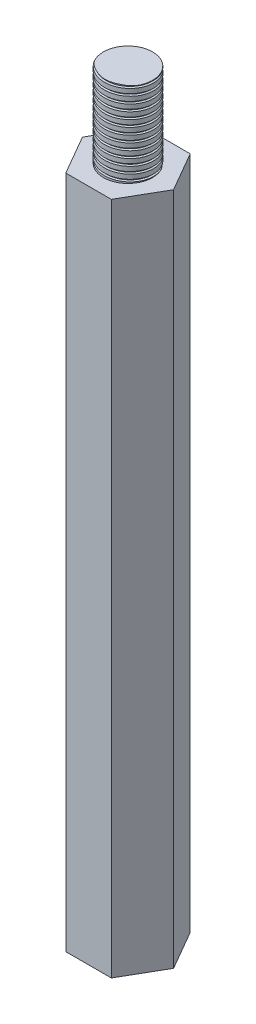
from build123d import *

# Parameters (mm, degrees)
SKETCH_1_R          = 1.46
EXTRUDE_1_DEPTH     = 40
SKETCH_1_3_R        = 1.46
CUT_EXTRUDE_1_DEPTH = 5
SKETCH_2_R          = 1.46
EXTRUDE_2_DEPTH     = 5
SWEEP_1_PITCH       = 0.4
SWEEP_1_FROM        = -0.1
SWEEP_2_PITCH       = 0.4


with BuildPart() as part:
    # 草图1 → 凸台-拉伸1 (new body)
    # profile 1 of 2: a face of its own
    with BuildSketch(Plane(origin=(0, 0, 0), x_dir=(1, 0, 0), z_dir=(0, 1, 0))):
        Polygon((-2.70199926, 0), (-1.35099963, -2.34), (1.35099963, -2.34), (2.70199926, 0), (1.35099963, 2.34), (-1.35099963, 2.34), align=None)
        Circle(SKETCH_1_R, mode=Mode.SUBTRACT)
    # profile 2 of 2: a face of its own
    with BuildSketch(Plane(origin=(0, 0, 0), x_dir=(1, 0, 0), z_dir=(0, 1, 0))):
        Circle(SKETCH_1_R)
    extrude(amount=EXTRUDE_1_DEPTH)

    # 草图1<3> → 切除-拉伸1 (cut)
    with BuildSketch(Plane(origin=(0, 0, 0), x_dir=(1, 0, 0), z_dir=(0, 1, 0))):
        with Locations(Location((0, 0, 0), (0, 0, 270))):
            Circle(SKETCH_1_3_R)
    extrude(amount=CUT_EXTRUDE_1_DEPTH, mode=Mode.SUBTRACT)

    # 切除-扫描2: arcs per turn and ends read off the stored shape
    # 切除-扫描2: the profile of 草图7 profile screwed along a right-hand helix through 23.75 turns, 6 arcs to a turn; built about Z, then put on its axis
    sweep_2_z = Axis((0, 0, 0), (0, 0, 1))
    sweep_2_corners = [(1.4597, 0, 0.1001), (1.66, 0, 0.033333333), (1.66, 0, -0.033333333), (1.4597, 0, -0.1001)]
    with BuildLine(mode=Mode.PRIVATE) as sweep_2_profile:
        Line(sweep_2_corners[0], sweep_2_corners[1])
        Line(sweep_2_corners[1], sweep_2_corners[2])
        Line(sweep_2_corners[2], sweep_2_corners[3])
        Line(sweep_2_corners[3], sweep_2_corners[0])
    sweep_2_cap = Face(sweep_2_profile.wire())
    sweep_2_turn_angles = [0, 30, 60, 90, 120, 150, 180, 210, 240, 270, 300, 330, 360]
    sweep_2_turn_weights = [1, 0.8660254037844387, 1, 0.8660254037844387, 1, 0.8660254037844387, 1, 0.8660254037844387, 1, 0.8660254037844387, 1, 0.8660254037844387, 1]
    sweep_2_turn_rails = [Edge.make_bspline([Vector(p[0], p[1], 0).rotate(sweep_2_z, sweep_2_turn_angles[k]) / sweep_2_turn_weights[k] + Vector(0, 0, p[2] + SWEEP_2_PITCH * sweep_2_turn_angles[k] / 360) for k in range(13)], [0, 0, 0, 1, 1, 2, 2, 3, 3, 4, 4, 5, 5, 6, 6, 6], 2, sweep_2_turn_weights) for p in sweep_2_corners]
    sweep_2_turn_sides = [Face.make_surface_from_curves(sweep_2_turn_rails[p[0]], sweep_2_turn_rails[p[1]]) for p in [(0, 1), (1, 2), (2, 3), (3, 0)]]
    sweep_2_last_angles = [8280, 8310, 8340, 8370, 8400, 8430, 8460, 8490, 8520, 8535, 8550]
    sweep_2_last_weights = [1, 0.8660254037844387, 1, 0.8660254037844387, 1, 0.8660254037844387, 1, 0.8660254037844387, 1, 0.965925826289056, 1]
    sweep_2_last_rails = [Edge.make_bspline([Vector(p[0], p[1], 0).rotate(sweep_2_z, sweep_2_last_angles[k]) / sweep_2_last_weights[k] + Vector(0, 0, p[2] + SWEEP_2_PITCH * sweep_2_last_angles[k] / 360) for k in range(11)], [0, 0, 0, 1, 1, 2, 2, 3, 3, 4, 4, 5, 5, 5], 2, sweep_2_last_weights) for p in sweep_2_corners]
    sweep_2_last_sides = [Face.make_surface_from_curves(sweep_2_last_rails[p[0]], sweep_2_last_rails[p[1]]) for p in [(0, 1), (1, 2), (2, 3), (3, 0)]]
    sweep_2 = Plane(origin=(0, 0, 0), x_dir=(0, 0, -1), z_dir=(0, 1, 0)) * Solid(Shell([*[p.moved(Location((0, 0, SWEEP_2_PITCH * i))) for i in range(23) for p in sweep_2_turn_sides], *sweep_2_last_sides, sweep_2_cap, sweep_2_cap.rotate(sweep_2_z, 8550).moved(Location((0, 0, SWEEP_2_PITCH * 8550 / 360)))]))
    add(sweep_2, mode=Mode.SUBTRACT)


with BuildPart() as body_2:
    # 草图2 → 凸台-拉伸2 (new body)
    with BuildSketch(Plane(origin=(0, 40, 0), x_dir=(1, 0, 0), z_dir=(0, 1, 0))):
        with Locations(Location((0, 0, 0), (0, 0, 270))):
            Circle(SKETCH_2_R)
    extrude(amount=EXTRUDE_2_DEPTH)

    # 切除-扫描1: arcs per turn and ends read off the stored shape
    # 切除-扫描1: the profile of 草图4 screwed along a left-hand helix through 18.75 turns, 6 arcs to a turn; built about Z, then put on its axis
    sweep_1_z = Axis((0, 0, 0), (0, 0, 1))
    sweep_1_corners = [(1.56, 5.45e-07, -0.400000022), (1.56, 5.45e-07, -0.200000022), (1.36, 4.75e-07, -0.266666689), (1.36, 4.75e-07, -0.333333356)]
    with BuildLine(mode=Mode.PRIVATE) as sweep_1_profile:
        Line(sweep_1_corners[0], sweep_1_corners[1])
        Line(sweep_1_corners[1], sweep_1_corners[2])
        Line(sweep_1_corners[2], sweep_1_corners[3])
        Line(sweep_1_corners[3], sweep_1_corners[0])
    sweep_1_cap = Face(sweep_1_profile.wire())
    sweep_1_turn_angles = [0, -30, -60, -90, -120, -150, -180, -210, -240, -270, -300, -330, -360]
    sweep_1_turn_weights = [1, 0.8660254037844387, 1, 0.8660254037844387, 1, 0.8660254037844387, 1, 0.8660254037844387, 1, 0.8660254037844387, 1, 0.8660254037844387, 1]
    sweep_1_turn_rails = [Edge.make_bspline([Vector(p[0], p[1], 0).rotate(sweep_1_z, sweep_1_turn_angles[k]) / sweep_1_turn_weights[k] + Vector(0, 0, p[2] + -SWEEP_1_PITCH * sweep_1_turn_angles[k] / 360) for k in range(13)], [0, 0, 0, 1, 1, 2, 2, 3, 3, 4, 4, 5, 5, 6, 6, 6], 2, sweep_1_turn_weights) for p in sweep_1_corners]
    sweep_1_turn_sides = [Face.make_surface_from_curves(sweep_1_turn_rails[p[0]], sweep_1_turn_rails[p[1]]) for p in [(0, 1), (1, 2), (2, 3), (3, 0)]]
    sweep_1_last_angles = [-6480, -6510, -6540, -6570, -6600, -6630, -6660, -6690, -6720, -6735, -6750]
    sweep_1_last_weights = [1, 0.8660254037844387, 1, 0.8660254037844387, 1, 0.8660254037844387, 1, 0.8660254037844387, 1, 0.9659258262889389, 1]
    sweep_1_last_rails = [Edge.make_bspline([Vector(p[0], p[1], 0).rotate(sweep_1_z, sweep_1_last_angles[k]) / sweep_1_last_weights[k] + Vector(0, 0, p[2] + -SWEEP_1_PITCH * sweep_1_last_angles[k] / 360) for k in range(11)], [0, 0, 0, 1, 1, 2, 2, 3, 3, 4, 4, 5, 5, 5], 2, sweep_1_last_weights) for p in sweep_1_corners]
    sweep_1_last_sides = [Face.make_surface_from_curves(sweep_1_last_rails[p[0]], sweep_1_last_rails[p[1]]) for p in [(0, 1), (1, 2), (2, 3), (3, 0)]]
    sweep_1 = Plane(origin=(0, 40.1, 0), x_dir=(0, 0, 1), z_dir=(0, 1, 0)) * split(Solid(Shell([*[p.moved(Location((0, 0, SWEEP_1_PITCH * i))) for i in range(18) for p in sweep_1_turn_sides], *sweep_1_last_sides, sweep_1_cap, sweep_1_cap.rotate(sweep_1_z, -6750).moved(Location((0, 0, -SWEEP_1_PITCH * -6750 / 360)))])), bisect_by=Plane.XY.offset(SWEEP_1_FROM), keep=Keep.TOP, mode=Mode.PRIVATE)
    add(sweep_1, mode=Mode.SUBTRACT)


solid = Compound([part.part, body_2.part])
